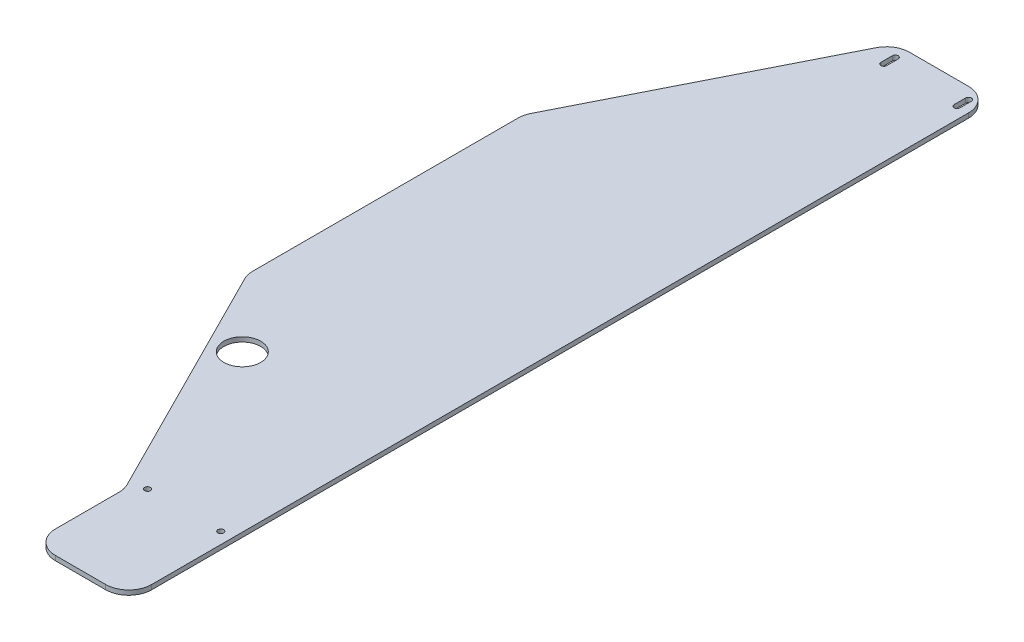
from build123d import *

# Parameters (mm, degrees)
SKETCH1_R           = 1.25
BOSS_EXTRUDE1_DEPTH = 2
SKETCH4_R           = 8
CUT_EXTRUDE3_DEPTH  = 340.109226651
FILLET1_R           = 10


with BuildPart() as part:
    # Sketch1 → Boss-Extrude1 (new body)
    with BuildSketch(Plane(origin=(0, 0, 0), x_dir=(1, 0, 0), z_dir=(0, 1, 0))):
        Polygon((-54.1, 107.38), (0, 0), (0, -40), (41.8, -40), (41.8, 334.76), (0, 334.76), (-54.1, 227.38), align=None)
        with Locations((5, 5)):
            Circle(SKETCH1_R, mode=Mode.SUBTRACT)
        with Locations((36.8, 5)):
            Circle(SKETCH1_R, mode=Mode.SUBTRACT)
        with BuildLine():
            ThreePointArc((3.75, 329.76), (5, 331.01), (6.25, 329.76))
            Line((6.25, 329.76), (6.25, 324.76))
            ThreePointArc((6.25, 324.76), (5, 323.51), (3.75, 324.76))
            Line((3.75, 324.76), (3.75, 329.76))
        make_face(mode=Mode.SUBTRACT)
        with BuildLine():
            ThreePointArc((35.55, 329.76), (36.8, 331.01), (38.05, 329.76))
            Line((38.05, 329.76), (38.05, 324.76))
            ThreePointArc((38.05, 324.76), (36.8, 323.51), (35.55, 324.76))
            Line((35.55, 324.76), (35.55, 329.76))
        make_face(mode=Mode.SUBTRACT)
    extrude(amount=BOSS_EXTRUDE1_DEPTH)

    # Sketch4 → Cut-Extrude3 (cut, through all)
    with BuildSketch(Plane(origin=(0, 2, 0), x_dir=(1, 0, 0), z_dir=(0, 1, 0))):
        with Locations((-26.05657058, 77.188258139)):
            Circle(SKETCH4_R)
    extrude(amount=-CUT_EXTRUDE3_DEPTH, mode=Mode.SUBTRACT)

    # Fillet1
    fillet1_edges = [part.edges().sort_by_distance(p)[0] for p in [
        (41.8, 1, -334.76),
        (0, 1, -334.76),
        (-54.1, 1, -227.38),
        (-54.1, 1, -107.38),
        (0, 1, 0),
        (0, 1, 40),
        (41.8, 1, 40),
    ]]
    fillet(fillet1_edges, radius=FILLET1_R)


solid = part.part
